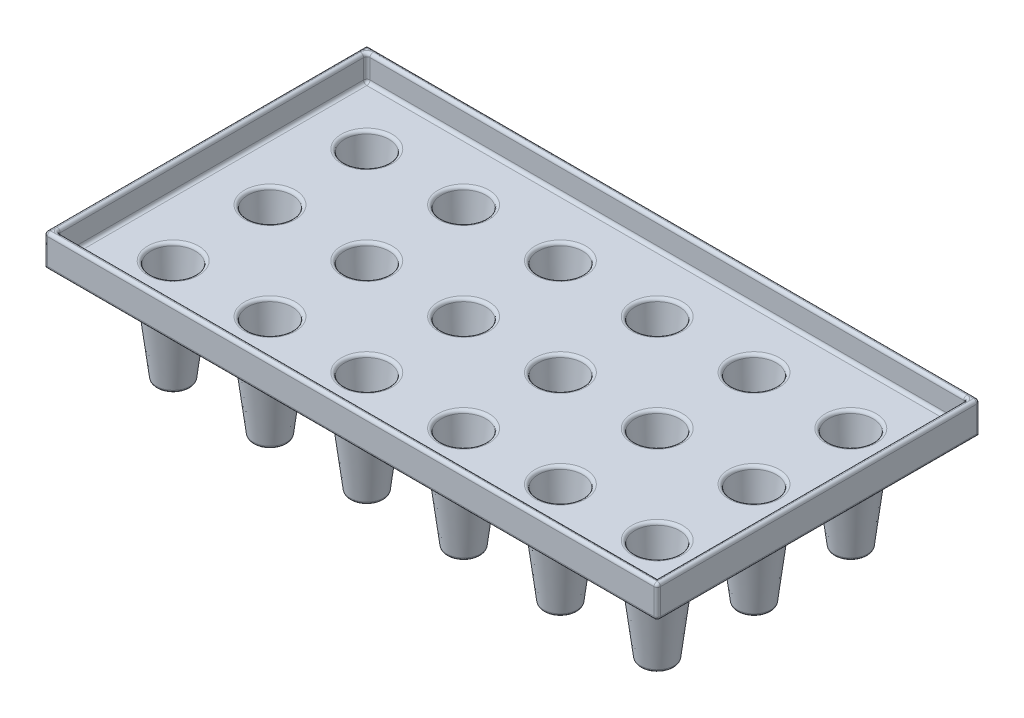
from build123d import *

# Parameters (mm, degrees)
SKETCH1_W                  = 241.3
SKETCH1_H                  = 127
BOSS_EXTRUDE1_DEPTH        = 12.7
SKETCH2_R                  = 12.7
BOSS_EXTRUDE2_DEPTH        = 50.8
BOSS_EXTRUDE2_DRAFT        = -7
LPATTERN1_COPY_1_SKETCH_R  = 12.7
LPATTERN1_COPY_1_DEPTH     = 50.8
LPATTERN1_COPY_1_DRAFT     = -7
LPATTERN1_COPY_2_SKETCH_R  = 12.7
LPATTERN1_COPY_2_DEPTH     = 50.8
LPATTERN1_COPY_2_DRAFT     = -7
LPATTERN1_COPY_3_SKETCH_R  = 12.7
LPATTERN1_COPY_3_DEPTH     = 50.8
LPATTERN1_COPY_3_DRAFT     = -7
LPATTERN1_COPY_4_SKETCH_R  = 12.7
LPATTERN1_COPY_4_DEPTH     = 50.8
LPATTERN1_COPY_4_DRAFT     = -7
LPATTERN1_COPY_5_SKETCH_R  = 12.7
LPATTERN1_COPY_5_DEPTH     = 50.8
LPATTERN1_COPY_5_DRAFT     = -7
LPATTERN1_COPY_6_SKETCH_R  = 12.7
LPATTERN1_COPY_6_DEPTH     = 50.8
LPATTERN1_COPY_6_DRAFT     = -7
LPATTERN1_COPY_7_SKETCH_R  = 12.7
LPATTERN1_COPY_7_DEPTH     = 50.8
LPATTERN1_COPY_7_DRAFT     = -7
LPATTERN1_COPY_8_SKETCH_R  = 12.7
LPATTERN1_COPY_8_DEPTH     = 50.8
LPATTERN1_COPY_8_DRAFT     = -7
LPATTERN1_COPY_9_SKETCH_R  = 12.7
LPATTERN1_COPY_9_DEPTH     = 50.8
LPATTERN1_COPY_9_DRAFT     = -7
LPATTERN1_COPY_10_SKETCH_R = 12.7
LPATTERN1_COPY_10_DEPTH    = 50.8
LPATTERN1_COPY_10_DRAFT    = -7
LPATTERN1_COPY_11_SKETCH_R = 12.7
LPATTERN1_COPY_11_DEPTH    = 50.8
LPATTERN1_COPY_11_DRAFT    = -7
LPATTERN1_COPY_12_SKETCH_R = 12.7
LPATTERN1_COPY_12_DEPTH    = 50.8
LPATTERN1_COPY_12_DRAFT    = -7
LPATTERN1_COPY_13_SKETCH_R = 12.7
LPATTERN1_COPY_13_DEPTH    = 50.8
LPATTERN1_COPY_13_DRAFT    = -7
LPATTERN1_COPY_14_SKETCH_R = 12.7
LPATTERN1_COPY_14_DEPTH    = 50.8
LPATTERN1_COPY_14_DRAFT    = -7
LPATTERN1_COPY_15_SKETCH_R = 12.7
LPATTERN1_COPY_15_DEPTH    = 50.8
LPATTERN1_COPY_15_DRAFT    = -7
LPATTERN1_COPY_16_SKETCH_R = 12.7
LPATTERN1_COPY_16_DEPTH    = 50.8
LPATTERN1_COPY_16_DRAFT    = -7
LPATTERN1_COPY_17_SKETCH_R = 12.7
LPATTERN1_COPY_17_DEPTH    = 50.8
LPATTERN1_COPY_17_DRAFT    = -7
SHELL1_T                   = -2.54
FILLET1_R                  = 1.27


with BuildPart() as part:
    # Sketch1 → Boss-Extrude1 (new body)
    with BuildSketch(Plane(origin=(0, 0, 0), x_dir=(1, 0, 0), z_dir=(0, 1, 0))):
        with Locations((-120.65, 63.5)):
            Rectangle(SKETCH1_W, SKETCH1_H)
    extrude(amount=-BOSS_EXTRUDE1_DEPTH)


with BuildPart() as boss_extrude2_tool:
    # Sketch2 → Boss-Extrude2 (with draft: the straight prism first)
    with BuildSketch(Plane(origin=(0, 0, 0), x_dir=(1, 0, 0), z_dir=(0, 1, 0))):
        with Locations((-215.9, 25.4)):
            Circle(SKETCH2_R)
    extrude(amount=-BOSS_EXTRUDE2_DEPTH)
    # Boss-Extrude2: the draft: its side faces are tilted about the plane it starts from
    boss_extrude2_sides = [boss_extrude2_tool.faces().sort_by_distance(p)[0] for p in [
        (-228.6, -25.4, -25.4),
    ]]
    draft(boss_extrude2_sides, Plane(origin=(0, 0, 0), x_dir=(1, 0, 0), z_dir=(0, 1, 0)), BOSS_EXTRUDE2_DRAFT)


with BuildPart() as part_1:
    add(part.part)

    # Boss-Extrude2: add boss_extrude2_tool
    add(boss_extrude2_tool.part)


with BuildPart() as lpattern1_copy_1_tool:
    # LPattern1 copy 1 sketch → LPattern1 copy 1 (with draft: the straight prism first)
    with BuildSketch(Plane(origin=(0, 0, -38.1), x_dir=(1, 0, 0), z_dir=(0, 1, 0))):
        with Locations((-215.9, 25.4)):
            Circle(LPATTERN1_COPY_1_SKETCH_R)
    extrude(amount=-LPATTERN1_COPY_1_DEPTH)
    # LPattern1 copy 1: the draft: its side faces are tilted about the plane it starts from
    lpattern1_copy_1_sides = [lpattern1_copy_1_tool.faces().sort_by_distance(p)[0] for p in [
        (-228.6, -25.4, -63.5),
    ]]
    draft(lpattern1_copy_1_sides, Plane(origin=(0, 0, -38.1), x_dir=(1, 0, 0), z_dir=(0, 1, 0)), LPATTERN1_COPY_1_DRAFT)


with BuildPart() as part_2:
    add(part_1.part)

    # LPattern1 copy 1: add lpattern1_copy_1_tool
    add(lpattern1_copy_1_tool.part)


with BuildPart() as lpattern1_copy_2_tool:
    # LPattern1 copy 2 sketch → LPattern1 copy 2 (with draft: the straight prism first)
    with BuildSketch(Plane(origin=(0, 0, -76.2), x_dir=(1, 0, 0), z_dir=(0, 1, 0))):
        with Locations((-215.9, 25.4)):
            Circle(LPATTERN1_COPY_2_SKETCH_R)
    extrude(amount=-LPATTERN1_COPY_2_DEPTH)
    # LPattern1 copy 2: the draft: its side faces are tilted about the plane it starts from
    lpattern1_copy_2_sides = [lpattern1_copy_2_tool.faces().sort_by_distance(p)[0] for p in [
        (-228.6, -25.4, -101.6),
    ]]
    draft(lpattern1_copy_2_sides, Plane(origin=(0, 0, -76.2), x_dir=(1, 0, 0), z_dir=(0, 1, 0)), LPATTERN1_COPY_2_DRAFT)


with BuildPart() as part_3:
    add(part_2.part)

    # LPattern1 copy 2: add lpattern1_copy_2_tool
    add(lpattern1_copy_2_tool.part)


with BuildPart() as lpattern1_copy_3_tool:
    # LPattern1 copy 3 sketch → LPattern1 copy 3 (with draft: the straight prism first)
    with BuildSketch(Plane(origin=(38.1, 0, 0), x_dir=(1, 0, 0), z_dir=(0, 1, 0))):
        with Locations((-215.9, 25.4)):
            Circle(LPATTERN1_COPY_3_SKETCH_R)
    extrude(amount=-LPATTERN1_COPY_3_DEPTH)
    # LPattern1 copy 3: the draft: its side faces are tilted about the plane it starts from
    lpattern1_copy_3_sides = [lpattern1_copy_3_tool.faces().sort_by_distance(p)[0] for p in [
        (-190.5, -25.4, -25.4),
    ]]
    draft(lpattern1_copy_3_sides, Plane(origin=(38.1, 0, 0), x_dir=(1, 0, 0), z_dir=(0, 1, 0)), LPATTERN1_COPY_3_DRAFT)


with BuildPart() as part_4:
    add(part_3.part)

    # LPattern1 copy 3: add lpattern1_copy_3_tool
    add(lpattern1_copy_3_tool.part)


with BuildPart() as lpattern1_copy_4_tool:
    # LPattern1 copy 4 sketch → LPattern1 copy 4 (with draft: the straight prism first)
    with BuildSketch(Plane(origin=(38.1, 0, -38.1), x_dir=(1, 0, 0), z_dir=(0, 1, 0))):
        with Locations((-215.9, 25.4)):
            Circle(LPATTERN1_COPY_4_SKETCH_R)
    extrude(amount=-LPATTERN1_COPY_4_DEPTH)
    # LPattern1 copy 4: the draft: its side faces are tilted about the plane it starts from
    lpattern1_copy_4_sides = [lpattern1_copy_4_tool.faces().sort_by_distance(p)[0] for p in [
        (-190.5, -25.4, -63.5),
    ]]
    draft(lpattern1_copy_4_sides, Plane(origin=(38.1, 0, -38.1), x_dir=(1, 0, 0), z_dir=(0, 1, 0)), LPATTERN1_COPY_4_DRAFT)


with BuildPart() as part_5:
    add(part_4.part)

    # LPattern1 copy 4: add lpattern1_copy_4_tool
    add(lpattern1_copy_4_tool.part)


with BuildPart() as lpattern1_copy_5_tool:
    # LPattern1 copy 5 sketch → LPattern1 copy 5 (with draft: the straight prism first)
    with BuildSketch(Plane(origin=(38.1, 0, -76.2), x_dir=(1, 0, 0), z_dir=(0, 1, 0))):
        with Locations((-215.9, 25.4)):
            Circle(LPATTERN1_COPY_5_SKETCH_R)
    extrude(amount=-LPATTERN1_COPY_5_DEPTH)
    # LPattern1 copy 5: the draft: its side faces are tilted about the plane it starts from
    lpattern1_copy_5_sides = [lpattern1_copy_5_tool.faces().sort_by_distance(p)[0] for p in [
        (-190.5, -25.4, -101.6),
    ]]
    draft(lpattern1_copy_5_sides, Plane(origin=(38.1, 0, -76.2), x_dir=(1, 0, 0), z_dir=(0, 1, 0)), LPATTERN1_COPY_5_DRAFT)


with BuildPart() as part_6:
    add(part_5.part)

    # LPattern1 copy 5: add lpattern1_copy_5_tool
    add(lpattern1_copy_5_tool.part)


with BuildPart() as lpattern1_copy_6_tool:
    # LPattern1 copy 6 sketch → LPattern1 copy 6 (with draft: the straight prism first)
    with BuildSketch(Plane(origin=(76.2, 0, 0), x_dir=(1, 0, 0), z_dir=(0, 1, 0))):
        with Locations((-215.9, 25.4)):
            Circle(LPATTERN1_COPY_6_SKETCH_R)
    extrude(amount=-LPATTERN1_COPY_6_DEPTH)
    # LPattern1 copy 6: the draft: its side faces are tilted about the plane it starts from
    lpattern1_copy_6_sides = [lpattern1_copy_6_tool.faces().sort_by_distance(p)[0] for p in [
        (-152.4, -25.4, -25.4),
    ]]
    draft(lpattern1_copy_6_sides, Plane(origin=(76.2, 0, 0), x_dir=(1, 0, 0), z_dir=(0, 1, 0)), LPATTERN1_COPY_6_DRAFT)


with BuildPart() as part_7:
    add(part_6.part)

    # LPattern1 copy 6: add lpattern1_copy_6_tool
    add(lpattern1_copy_6_tool.part)


with BuildPart() as lpattern1_copy_7_tool:
    # LPattern1 copy 7 sketch → LPattern1 copy 7 (with draft: the straight prism first)
    with BuildSketch(Plane(origin=(76.2, 0, -38.1), x_dir=(1, 0, 0), z_dir=(0, 1, 0))):
        with Locations((-215.9, 25.4)):
            Circle(LPATTERN1_COPY_7_SKETCH_R)
    extrude(amount=-LPATTERN1_COPY_7_DEPTH)
    # LPattern1 copy 7: the draft: its side faces are tilted about the plane it starts from
    lpattern1_copy_7_sides = [lpattern1_copy_7_tool.faces().sort_by_distance(p)[0] for p in [
        (-152.4, -25.4, -63.5),
    ]]
    draft(lpattern1_copy_7_sides, Plane(origin=(76.2, 0, -38.1), x_dir=(1, 0, 0), z_dir=(0, 1, 0)), LPATTERN1_COPY_7_DRAFT)


with BuildPart() as part_8:
    add(part_7.part)

    # LPattern1 copy 7: add lpattern1_copy_7_tool
    add(lpattern1_copy_7_tool.part)


with BuildPart() as lpattern1_copy_8_tool:
    # LPattern1 copy 8 sketch → LPattern1 copy 8 (with draft: the straight prism first)
    with BuildSketch(Plane(origin=(76.2, 0, -76.2), x_dir=(1, 0, 0), z_dir=(0, 1, 0))):
        with Locations((-215.9, 25.4)):
            Circle(LPATTERN1_COPY_8_SKETCH_R)
    extrude(amount=-LPATTERN1_COPY_8_DEPTH)
    # LPattern1 copy 8: the draft: its side faces are tilted about the plane it starts from
    lpattern1_copy_8_sides = [lpattern1_copy_8_tool.faces().sort_by_distance(p)[0] for p in [
        (-152.4, -25.4, -101.6),
    ]]
    draft(lpattern1_copy_8_sides, Plane(origin=(76.2, 0, -76.2), x_dir=(1, 0, 0), z_dir=(0, 1, 0)), LPATTERN1_COPY_8_DRAFT)


with BuildPart() as part_9:
    add(part_8.part)

    # LPattern1 copy 8: add lpattern1_copy_8_tool
    add(lpattern1_copy_8_tool.part)


with BuildPart() as lpattern1_copy_9_tool:
    # LPattern1 copy 9 sketch → LPattern1 copy 9 (with draft: the straight prism first)
    with BuildSketch(Plane(origin=(114.3, 0, 0), x_dir=(1, 0, 0), z_dir=(0, 1, 0))):
        with Locations((-215.9, 25.4)):
            Circle(LPATTERN1_COPY_9_SKETCH_R)
    extrude(amount=-LPATTERN1_COPY_9_DEPTH)
    # LPattern1 copy 9: the draft: its side faces are tilted about the plane it starts from
    lpattern1_copy_9_sides = [lpattern1_copy_9_tool.faces().sort_by_distance(p)[0] for p in [
        (-114.3, -25.4, -25.4),
    ]]
    draft(lpattern1_copy_9_sides, Plane(origin=(114.3, 0, 0), x_dir=(1, 0, 0), z_dir=(0, 1, 0)), LPATTERN1_COPY_9_DRAFT)


with BuildPart() as part_10:
    add(part_9.part)

    # LPattern1 copy 9: add lpattern1_copy_9_tool
    add(lpattern1_copy_9_tool.part)


with BuildPart() as lpattern1_copy_10_tool:
    # LPattern1 copy 10 sketch → LPattern1 copy 10 (with draft: the straight prism first)
    with BuildSketch(Plane(origin=(114.3, 0, -38.1), x_dir=(1, 0, 0), z_dir=(0, 1, 0))):
        with Locations((-215.9, 25.4)):
            Circle(LPATTERN1_COPY_10_SKETCH_R)
    extrude(amount=-LPATTERN1_COPY_10_DEPTH)
    # LPattern1 copy 10: the draft: its side faces are tilted about the plane it starts from
    lpattern1_copy_10_sides = [lpattern1_copy_10_tool.faces().sort_by_distance(p)[0] for p in [
        (-114.3, -25.4, -63.5),
    ]]
    draft(lpattern1_copy_10_sides, Plane(origin=(114.3, 0, -38.1), x_dir=(1, 0, 0), z_dir=(0, 1, 0)), LPATTERN1_COPY_10_DRAFT)


with BuildPart() as part_11:
    add(part_10.part)

    # LPattern1 copy 10: add lpattern1_copy_10_tool
    add(lpattern1_copy_10_tool.part)


with BuildPart() as lpattern1_copy_11_tool:
    # LPattern1 copy 11 sketch → LPattern1 copy 11 (with draft: the straight prism first)
    with BuildSketch(Plane(origin=(114.3, 0, -76.2), x_dir=(1, 0, 0), z_dir=(0, 1, 0))):
        with Locations((-215.9, 25.4)):
            Circle(LPATTERN1_COPY_11_SKETCH_R)
    extrude(amount=-LPATTERN1_COPY_11_DEPTH)
    # LPattern1 copy 11: the draft: its side faces are tilted about the plane it starts from
    lpattern1_copy_11_sides = [lpattern1_copy_11_tool.faces().sort_by_distance(p)[0] for p in [
        (-114.3, -25.4, -101.6),
    ]]
    draft(lpattern1_copy_11_sides, Plane(origin=(114.3, 0, -76.2), x_dir=(1, 0, 0), z_dir=(0, 1, 0)), LPATTERN1_COPY_11_DRAFT)


with BuildPart() as part_12:
    add(part_11.part)

    # LPattern1 copy 11: add lpattern1_copy_11_tool
    add(lpattern1_copy_11_tool.part)


with BuildPart() as lpattern1_copy_12_tool:
    # LPattern1 copy 12 sketch → LPattern1 copy 12 (with draft: the straight prism first)
    with BuildSketch(Plane(origin=(152.4, 0, 0), x_dir=(1, 0, 0), z_dir=(0, 1, 0))):
        with Locations((-215.9, 25.4)):
            Circle(LPATTERN1_COPY_12_SKETCH_R)
    extrude(amount=-LPATTERN1_COPY_12_DEPTH)
    # LPattern1 copy 12: the draft: its side faces are tilted about the plane it starts from
    lpattern1_copy_12_sides = [lpattern1_copy_12_tool.faces().sort_by_distance(p)[0] for p in [
        (-76.2, -25.4, -25.4),
    ]]
    draft(lpattern1_copy_12_sides, Plane(origin=(152.4, 0, 0), x_dir=(1, 0, 0), z_dir=(0, 1, 0)), LPATTERN1_COPY_12_DRAFT)


with BuildPart() as part_13:
    add(part_12.part)

    # LPattern1 copy 12: add lpattern1_copy_12_tool
    add(lpattern1_copy_12_tool.part)


with BuildPart() as lpattern1_copy_13_tool:
    # LPattern1 copy 13 sketch → LPattern1 copy 13 (with draft: the straight prism first)
    with BuildSketch(Plane(origin=(152.4, 0, -38.1), x_dir=(1, 0, 0), z_dir=(0, 1, 0))):
        with Locations((-215.9, 25.4)):
            Circle(LPATTERN1_COPY_13_SKETCH_R)
    extrude(amount=-LPATTERN1_COPY_13_DEPTH)
    # LPattern1 copy 13: the draft: its side faces are tilted about the plane it starts from
    lpattern1_copy_13_sides = [lpattern1_copy_13_tool.faces().sort_by_distance(p)[0] for p in [
        (-76.2, -25.4, -63.5),
    ]]
    draft(lpattern1_copy_13_sides, Plane(origin=(152.4, 0, -38.1), x_dir=(1, 0, 0), z_dir=(0, 1, 0)), LPATTERN1_COPY_13_DRAFT)


with BuildPart() as part_14:
    add(part_13.part)

    # LPattern1 copy 13: add lpattern1_copy_13_tool
    add(lpattern1_copy_13_tool.part)


with BuildPart() as lpattern1_copy_14_tool:
    # LPattern1 copy 14 sketch → LPattern1 copy 14 (with draft: the straight prism first)
    with BuildSketch(Plane(origin=(152.4, 0, -76.2), x_dir=(1, 0, 0), z_dir=(0, 1, 0))):
        with Locations((-215.9, 25.4)):
            Circle(LPATTERN1_COPY_14_SKETCH_R)
    extrude(amount=-LPATTERN1_COPY_14_DEPTH)
    # LPattern1 copy 14: the draft: its side faces are tilted about the plane it starts from
    lpattern1_copy_14_sides = [lpattern1_copy_14_tool.faces().sort_by_distance(p)[0] for p in [
        (-76.2, -25.4, -101.6),
    ]]
    draft(lpattern1_copy_14_sides, Plane(origin=(152.4, 0, -76.2), x_dir=(1, 0, 0), z_dir=(0, 1, 0)), LPATTERN1_COPY_14_DRAFT)


with BuildPart() as part_15:
    add(part_14.part)

    # LPattern1 copy 14: add lpattern1_copy_14_tool
    add(lpattern1_copy_14_tool.part)


with BuildPart() as lpattern1_copy_15_tool:
    # LPattern1 copy 15 sketch → LPattern1 copy 15 (with draft: the straight prism first)
    with BuildSketch(Plane(origin=(190.5, 0, 0), x_dir=(1, 0, 0), z_dir=(0, 1, 0))):
        with Locations((-215.9, 25.4)):
            Circle(LPATTERN1_COPY_15_SKETCH_R)
    extrude(amount=-LPATTERN1_COPY_15_DEPTH)
    # LPattern1 copy 15: the draft: its side faces are tilted about the plane it starts from
    lpattern1_copy_15_sides = [lpattern1_copy_15_tool.faces().sort_by_distance(p)[0] for p in [
        (-38.1, -25.4, -25.4),
    ]]
    draft(lpattern1_copy_15_sides, Plane(origin=(190.5, 0, 0), x_dir=(1, 0, 0), z_dir=(0, 1, 0)), LPATTERN1_COPY_15_DRAFT)


with BuildPart() as part_16:
    add(part_15.part)

    # LPattern1 copy 15: add lpattern1_copy_15_tool
    add(lpattern1_copy_15_tool.part)


with BuildPart() as lpattern1_copy_16_tool:
    # LPattern1 copy 16 sketch → LPattern1 copy 16 (with draft: the straight prism first)
    with BuildSketch(Plane(origin=(190.5, 0, -38.1), x_dir=(1, 0, 0), z_dir=(0, 1, 0))):
        with Locations((-215.9, 25.4)):
            Circle(LPATTERN1_COPY_16_SKETCH_R)
    extrude(amount=-LPATTERN1_COPY_16_DEPTH)
    # LPattern1 copy 16: the draft: its side faces are tilted about the plane it starts from
    lpattern1_copy_16_sides = [lpattern1_copy_16_tool.faces().sort_by_distance(p)[0] for p in [
        (-38.1, -25.4, -63.5),
    ]]
    draft(lpattern1_copy_16_sides, Plane(origin=(190.5, 0, -38.1), x_dir=(1, 0, 0), z_dir=(0, 1, 0)), LPATTERN1_COPY_16_DRAFT)


with BuildPart() as part_17:
    add(part_16.part)

    # LPattern1 copy 16: add lpattern1_copy_16_tool
    add(lpattern1_copy_16_tool.part)


with BuildPart() as lpattern1_copy_17_tool:
    # LPattern1 copy 17 sketch → LPattern1 copy 17 (with draft: the straight prism first)
    with BuildSketch(Plane(origin=(190.5, 0, -76.2), x_dir=(1, 0, 0), z_dir=(0, 1, 0))):
        with Locations((-215.9, 25.4)):
            Circle(LPATTERN1_COPY_17_SKETCH_R)
    extrude(amount=-LPATTERN1_COPY_17_DEPTH)
    # LPattern1 copy 17: the draft: its side faces are tilted about the plane it starts from
    lpattern1_copy_17_sides = [lpattern1_copy_17_tool.faces().sort_by_distance(p)[0] for p in [
        (-38.1, -25.4, -101.6),
    ]]
    draft(lpattern1_copy_17_sides, Plane(origin=(190.5, 0, -76.2), x_dir=(1, 0, 0), z_dir=(0, 1, 0)), LPATTERN1_COPY_17_DRAFT)


with BuildPart() as part_18:
    add(part_17.part)

    # LPattern1 copy 17: add lpattern1_copy_17_tool
    add(lpattern1_copy_17_tool.part)

    # Shell1
    shell1_openings = [part_18.faces().sort_by_distance(p)[0] for p in [
        (-120.65, 0, -63.5),
    ]]
    offset(amount=SHELL1_T, openings=shell1_openings, kind=Kind.INTERSECTION)

    # Fillet1
    fillet1_edges = [part_18.edges().sort_by_distance(p)[0] for p in [
        (-120.65, -12.7, 0),
        (-222.362544306, -50.8, -25.4),
        (-227.040636077, -12.7, -25.4),
        (-188.940636077, -12.7, -25.4),
        (-184.262544306, -50.8, -25.4),
        (-150.840636077, -12.7, -25.4),
        (-146.162544306, -50.8, -25.4),
        (-112.740636077, -12.7, -25.4),
        (-108.062544306, -50.8, -25.4),
        (-74.640636077, -12.7, -25.4),
        (-69.962544306, -50.8, -25.4),
        (-36.540636077, -12.7, -25.4),
        (-31.862544306, -50.8, -25.4),
        (-227.040636077, -12.7, -63.5),
        (-222.362544306, -50.8, -63.5),
        (-188.940636077, -12.7, -63.5),
        (-184.262544306, -50.8, -63.5),
        (-150.840636077, -12.7, -63.5),
        (-146.162544306, -50.8, -63.5),
        (-112.740636077, -12.7, -63.5),
        (-108.062544306, -50.8, -63.5),
        (-74.640636077, -12.7, -63.5),
        (-69.962544306, -50.8, -63.5),
        (-36.540636077, -12.7, -63.5),
        (0, -12.7, -63.5),
        (-31.862544306, -50.8, -63.5),
        (-227.040636077, -12.7, -101.6),
        (-222.362544306, -50.8, -101.6),
        (-188.940636077, -12.7, -101.6),
        (-184.262544306, -50.8, -101.6),
        (-120.65, 0, 0),
        (-150.840636077, -12.7, -101.6),
        (-146.162544306, -50.8, -101.6),
        (-112.740636077, -12.7, -101.6),
        (-108.062544306, -50.8, -101.6),
        (-241.3, 0, -63.5),
        (-74.640636077, -12.7, -101.6),
        (-69.962544306, -50.8, -101.6),
        (-36.540636077, -12.7, -101.6),
        (-31.862544306, -50.8, -101.6),
        (-120.65, 0, -127),
        (0, 0, -63.5),
        (-29.615342134, -48.26, -101.6),
        (-67.715342134, -48.26, -101.6),
        (-105.815342134, -48.26, -101.6),
        (-143.915342134, -48.26, -101.6),
        (-182.015342134, -48.26, -101.6),
        (-220.115342134, -48.26, -101.6),
        (-29.615342134, -48.26, -63.5),
        (-67.715342134, -48.26, -63.5),
        (-105.815342134, -48.26, -63.5),
        (-143.915342134, -48.26, -63.5),
        (-182.015342134, -48.26, -63.5),
        (-220.115342134, -48.26, -63.5),
        (-29.615342134, -48.26, -25.4),
        (-67.715342134, -48.26, -25.4),
        (-105.815342134, -48.26, -25.4),
        (-143.915342134, -48.26, -25.4),
        (-2.54, -10.16, -63.5),
        (-2.54, -5.08, -124.46),
        (-120.65, -10.16, -2.54),
        (-238.76, -10.16, -63.5),
        (-238.76, -5.08, -2.54),
        (0, -6.35, 0),
        (-120.65, -10.16, -124.46),
        (-238.76, -5.08, -124.46),
        (-186.693433905, -10.16, -25.4),
        (-224.793433905, -10.16, -25.4),
        (-148.593433905, -10.16, -25.4),
        (-110.493433905, -10.16, -25.4),
        (-72.393433905, -10.16, -25.4),
        (-34.293433905, -10.16, -25.4),
        (-224.793433905, -10.16, -63.5),
        (-186.693433905, -10.16, -63.5),
        (-241.3, -6.35, 0),
        (-148.593433905, -10.16, -63.5),
        (-110.493433905, -10.16, -63.5),
        (-72.393433905, -10.16, -63.5),
        (-34.293433905, -10.16, -63.5),
        (-224.793433905, -10.16, -101.6),
        (-186.693433905, -10.16, -101.6),
        (-148.593433905, -10.16, -101.6),
        (-110.493433905, -10.16, -101.6),
        (-72.393433905, -10.16, -101.6),
        (-34.293433905, -10.16, -101.6),
        (-2.54, 0, -63.5),
        (-120.65, 0, -124.46),
        (-238.76, 0, -63.5),
        (-120.65, 0, -2.54),
        (-220.115342134, -48.26, -25.4),
        (-182.015342134, -48.26, -25.4),
        (0, -6.35, -127),
    ]]
    fillet(fillet1_edges, radius=FILLET1_R - 0.0001)  # a hair under: the kernel refuses the full size


solid = part_18.part
